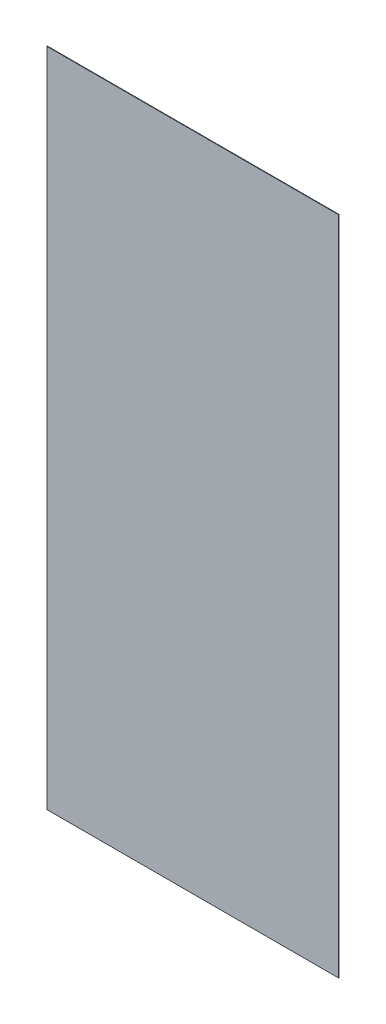
from build123d import *

# Parameters (mm, degrees)
SKETCH1_W          = 548.58
SKETCH1_H          = 1243
BASE_FLANGE1_DEPTH = 1


# Sheet-metal steps are written as plain solids
with BuildPart() as part:
    # Sketch1 → Base-Flange1 (new body)
    with BuildSketch(Plane.XY):
        with Locations((274.29, 621.5)):
            Rectangle(SKETCH1_W, SKETCH1_H)
    extrude(amount=-BASE_FLANGE1_DEPTH)


solid = part.part
